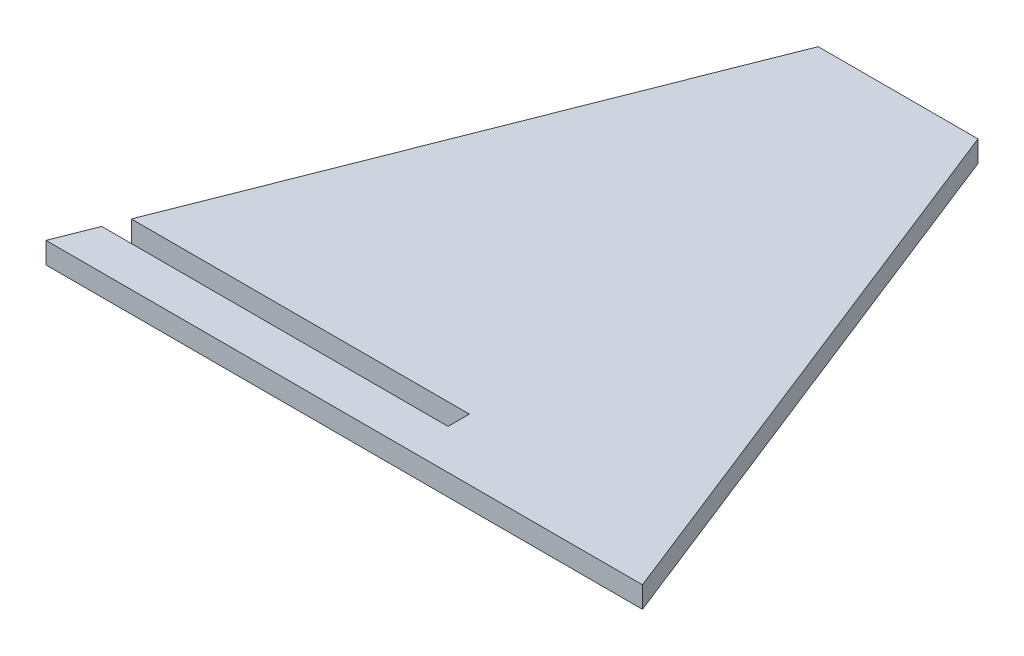
from build123d import *

# Parameters (mm, degrees)
SM_BASE_FLANGE_1_DEPTH   = 4
OTHER_START              = -11.5
OTHER_2_DEPTH            = 4
CUT_EXTRUDE_1_DEPTH      = 126.982552614
CUT_EXTRUDE_1_DEPTH_BACK = 126.982552614
SKETCH_7_W               = 3.023259835
SKETCH_7_H               = 4


# Read off the part's stored shape, not the designer's step: Полость2
# Sheet-metal steps are written as plain solids
with BuildPart() as part:
    # Sketch 2 → Базовая кромка1 (new body)
    with BuildSketch(Plane(origin=(0, 0, 0), x_dir=(1, 0, 0), z_dir=(0, 1, 0))):
        Polygon((41, 0), (-70.990165257, 0), (-30, 104), (0, 104), align=None)
    extrude(amount=SM_BASE_FLANGE_1_DEPTH)

    # Полость2 outline → Полость2 (cut)
    with BuildSketch(Plane.XY.offset(OTHER_START)):
        Polygon((-70, 0), (-3, 0), (-6.023259835, 4), (-70, 4), align=None)
    extrude(amount=OTHER_2_DEPTH, mode=Mode.SUBTRACT)

    # Эскиз7 → Вырез-Вытянуть1 (cut, two sides: drawn at the far end of the back side and taken through both)
    with BuildSketch(Plane(origin=(0, 4, 0), x_dir=(1, 0, 0), z_dir=(0, 1, 0)).offset(-CUT_EXTRUDE_1_DEPTH_BACK)):
        with Locations((-4.511629918, 9.5)):
            Rectangle(SKETCH_7_W, SKETCH_7_H)
    extrude(amount=CUT_EXTRUDE_1_DEPTH + CUT_EXTRUDE_1_DEPTH_BACK, mode=Mode.SUBTRACT)


solid = part.part
